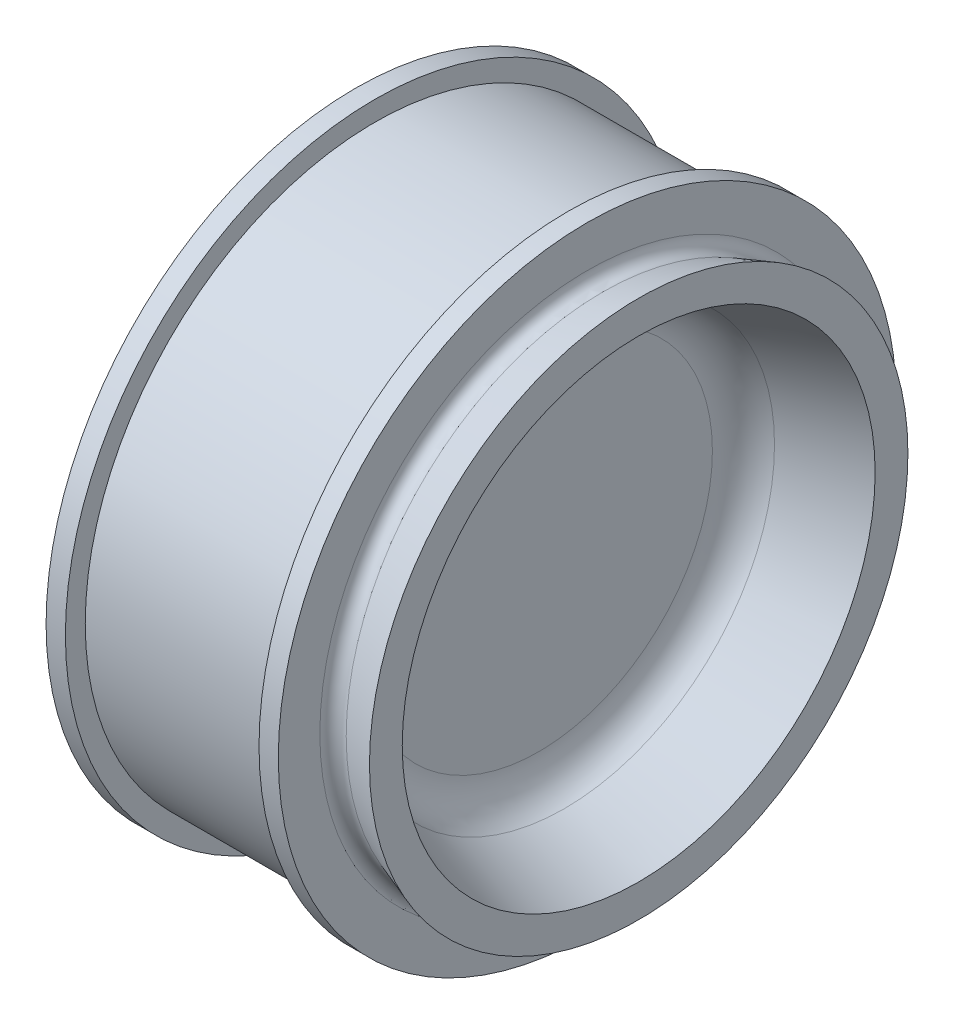
from build123d import *
from build123d.topology import SkipClean

# Parameters (mm, degrees)
ESBO_O2_R                = 15
RESSALTO_EXTRUS_O1_DEPTH = 30
FILETE1_R                = 10
FILETE5_R                = 3
RESSALTO_EXTRUS_O3_DEPTH = 30
RESSALTO_EXTRUS_O4_START = -30
ESBO_O9_R                = 3
RESSALTO_EXTRUS_O4_DEPTH = 30
ESBO_O10_R               = 3
RESSALTO_EXTRUS_O5_DEPTH = 2
CORTE_EXTRUS_O1_START    = -0.3
ESBO_O14_R               = 3
CORTE_EXTRUS_O1_DEPTH    = 0.3
RESSALTO_EXTRUS_O6_START = -27
RESSALTO_EXTRUS_O6_DEPTH = 27


with BuildPart() as part:
    # Esboço1 → Revolução2 (revolve)
    with BuildSketch(Plane.XY, mode=Mode.PRIVATE) as revolu_o2_sk:
        Polygon((30, 69.858349347), (30, 4.858349347), (0, 4.858349347), (0, 19.858349347), (22.5, 19.858349347), (22.5, 69.858349347), (-30, 69.858349347), (-30, 85), (-25, 85), (-25, 79.858349347), (25, 79.858349347), (25, 84.858349347), (30, 84.858349347), align=None)
    revolve(revolu_o2_sk.sketch.rotate(Axis((-56.599013794, 4.858349347, 0), (1, 0, 0)), 90), axis=Axis((-56.599013794, 4.858349347, 0), (1, 0, 0)))

    # Esboço2 → Ressalto-extrusão1 (add)
    with BuildSketch(Plane(origin=(0, 0, 0), x_dir=(0, 0, -1), z_dir=(1, 0, 0))):
        with Locations(Location((0, 4.858349347, 0), (0, 0, 180))):
            Circle(ESBO_O2_R)
        with BuildLine():
            Line((-2.958039892, 5.358349347), (-4.5, 5.358349347))
            Line((-4.5, 5.358349347), (-4.5, 4.358349347))
            Line((-4.5, 4.358349347), (-2.958039892, 4.358349347))
            ThreePointArc((-2.958039892, 4.358349347), (-2.121320344, 2.737029004), (-0.5, 1.900309456))
            Line((-0.5, 1.900309456), (-0.5, 0.358349347))
            Line((-0.5, 0.358349347), (0.5, 0.358349347))
            Line((0.5, 0.358349347), (0.5, 1.900309456))
            ThreePointArc((0.5, 1.900309456), (2.121320344, 2.737029004), (2.958039892, 4.358349347))
            Line((2.958039892, 4.358349347), (4.5, 4.358349347))
            Line((4.5, 4.358349347), (4.5, 5.358349347))
            Line((4.5, 5.358349347), (2.958039892, 5.358349347))
            ThreePointArc((2.958039892, 5.358349347), (2.120440089, 6.98054958), (0.497545425, 7.81680309))
            Line((0.497545425, 7.81680309), (0.497545425, 9.358349347))
            Line((0.497545425, 9.358349347), (-0.5, 9.358349347))
            Line((-0.5, 9.358349347), (-0.5, 7.816389239))
            ThreePointArc((-0.5, 7.816389239), (-2.121320344, 6.979669691), (-2.958039892, 5.358349347))
        make_face(mode=Mode.SUBTRACT)
    extrude(amount=-RESSALTO_EXTRUS_O1_DEPTH)

    # Esboço4 → Revolução3 (revolve)
    with BuildSketch(Plane.XY, mode=Mode.PRIVATE) as revolu_o3_sk:
        Polygon((0, 59.226522002), (0, 4.858349347), (43.32899264, 4.858349347), (43.32899264, 74.582067629), align=None)
    revolve(revolu_o3_sk.sketch.rotate(Axis((-90.113441675, 4.858349347, 0), (1, 0, 0)), 270), axis=Axis((-90.113441675, 4.858349347, 0), (1, 0, 0)))

    # Esboço5 → Corte-Revolução3 (revolve, cut)
    with BuildSketch(Plane.XY, mode=Mode.PRIVATE) as corte_revolu_o3_sk:
        Polygon((43.32899264, 4.858349347), (43.32899264, 66.094541607), (32.672301871, 62.317871729), (22.015611102, 58.541201852), (17.426446921, 56.914828477), (17.426446921, 4.858349347), align=None)
    revolve(corte_revolu_o3_sk.sketch.rotate(Axis((17.426446921, 4.858349347, 0), (1, 0, 0)), 90), axis=Axis((17.426446921, 4.858349347, 0), (1, 0, 0)), mode=Mode.SUBTRACT)

    # Filete1
    filete1_edges = [part.edges().sort_by_distance(p)[0] for p in [
        (17.426446921, 4.858349347, -52.05647913),
    ]]
    fillet(filete1_edges, radius=FILETE1_R)

    # Filete5
    filete5_edges = [part.edges().sort_by_distance(p)[0] for p in [
        (30, 4.858349347, 65),
    ]]
    fillet(filete5_edges, radius=FILETE5_R)

    # Esboço7 → Ressalto-extrusão3 (add)
    with BuildSketch(Plane.ZY.offset(30)):
        with BuildLine():
            Line((-11, 15.056388374), (-64.195015383, 15.056388374))
            ThreePointArc((-64.195015383, 15.056388374), (-65, 4.858349347), (-64.195015383, -5.33968968))
            Line((-64.195015383, -5.33968968), (-11, -5.33968968))
            ThreePointArc((-11, -5.33968968), (-15, 4.858349347), (-11, 15.056388374))
        make_face()
        with BuildLine():
            Line((11, -5.33968968), (64.195015383, -5.33968968))
            ThreePointArc((64.195015383, -5.33968968), (65, 4.858349347), (64.195015383, 15.056388374))
            Line((64.195015383, 15.056388374), (11, 15.056388374))
            ThreePointArc((11, 15.056388374), (15, 4.858349347), (11, -5.33968968))
        make_face()
    extrude(amount=-RESSALTO_EXTRUS_O3_DEPTH)

    # Esboço9 → Ressalto-extrusão4 (add)
    with BuildSketch(Plane.ZY.offset(20.2).offset(RESSALTO_EXTRUS_O4_START)):
        with Locations((0, 4.858349347)):
            Circle(ESBO_O9_R)
    extrude(amount=RESSALTO_EXTRUS_O4_DEPTH)

    # Esboço10 → Ressalto-extrusão5 (add)
    with BuildSketch(Plane.ZY.offset(20.2)):
        with Locations((0, 4.858349347)):
            Circle(ESBO_O10_R)
    extrude(amount=RESSALTO_EXTRUS_O5_DEPTH)

    # Esboço14 → Corte-extrusão1 (cut)
    with SkipClean():  # the faces are left unmerged after this step: merging them gives an invalid solid
        with BuildSketch(Plane.ZY.offset(22.2).offset(CORTE_EXTRUS_O1_START)):
            with Locations((0, 4.858349347)):
                Circle(ESBO_O14_R)
        extrude(amount=CORTE_EXTRUS_O1_DEPTH, mode=Mode.SUBTRACT)
    add(part.part.scale(1), mode=Mode.REPLACE)  # the faces are merged on a copy

    # Esboço15 → Ressalto-extrusão6 (add)
    with SkipClean():  # the faces are left unmerged after this step: merging them gives an invalid solid
        with BuildSketch(Plane.ZY.offset(21.9).offset(RESSALTO_EXTRUS_O6_START)):
            with BuildLine():
                Line((-2.958039892, 5.358349347), (-4.5, 5.358349347))
                Line((-4.5, 5.358349347), (-4.5, 4.358349347))
                Line((-4.5, 4.358349347), (-2.958039892, 4.358349347))
                ThreePointArc((-2.958039892, 4.358349347), (-3, 4.858349347), (-2.958039892, 5.358349347))
            make_face()
            with BuildLine():
                Line((0.5, 7.816389239), (0.5, 9.358349347))
                Line((0.5, 9.358349347), (-0.497545425, 9.358349347))
                Line((-0.497545425, 9.358349347), (-0.497545425, 7.81680309))
                ThreePointArc((-0.497545425, 7.81680309), (0.00124461, 7.858349089), (0.5, 7.816389239))
            make_face()
            with BuildLine():
                Line((2.958039892, 4.358349347), (4.5, 4.358349347))
                Line((4.5, 4.358349347), (4.5, 5.358349347))
                Line((4.5, 5.358349347), (2.958039892, 5.358349347))
                ThreePointArc((2.958039892, 5.358349347), (3, 4.858349347), (2.958039892, 4.358349347))
            make_face()
            with BuildLine():
                ThreePointArc((2.958039892, 4.358349347), (3, 4.858349347), (2.958039892, 5.358349347))
                ThreePointArc((2.958039892, 5.358349347), (2.121320344, 6.979669691), (0.5, 7.816389239))
                ThreePointArc((0.5, 7.816389239), (0.00124461, 7.858349089), (-0.497545425, 7.81680309))
                ThreePointArc((-0.497545425, 7.81680309), (-2.120440089, 6.98054958), (-2.958039892, 5.358349347))
                ThreePointArc((-2.958039892, 5.358349347), (-3, 4.858349347), (-2.958039892, 4.358349347))
                ThreePointArc((-2.958039892, 4.358349347), (-2.121320344, 2.737029004), (-0.5, 1.900309456))
                ThreePointArc((-0.5, 1.900309456), (0, 1.858349347), (0.5, 1.900309456))
                ThreePointArc((0.5, 1.900309456), (2.121320344, 2.737029004), (2.958039892, 4.358349347))
            make_face()
            with BuildLine():
                Line((-0.5, 1.900309456), (-0.5, 0.358349347))
                Line((-0.5, 0.358349347), (0.5, 0.358349347))
                Line((0.5, 0.358349347), (0.5, 1.900309456))
                ThreePointArc((0.5, 1.900309456), (0, 1.858349347), (-0.5, 1.900309456))
            make_face()
        extrude(amount=RESSALTO_EXTRUS_O6_DEPTH)


solid = part.part
